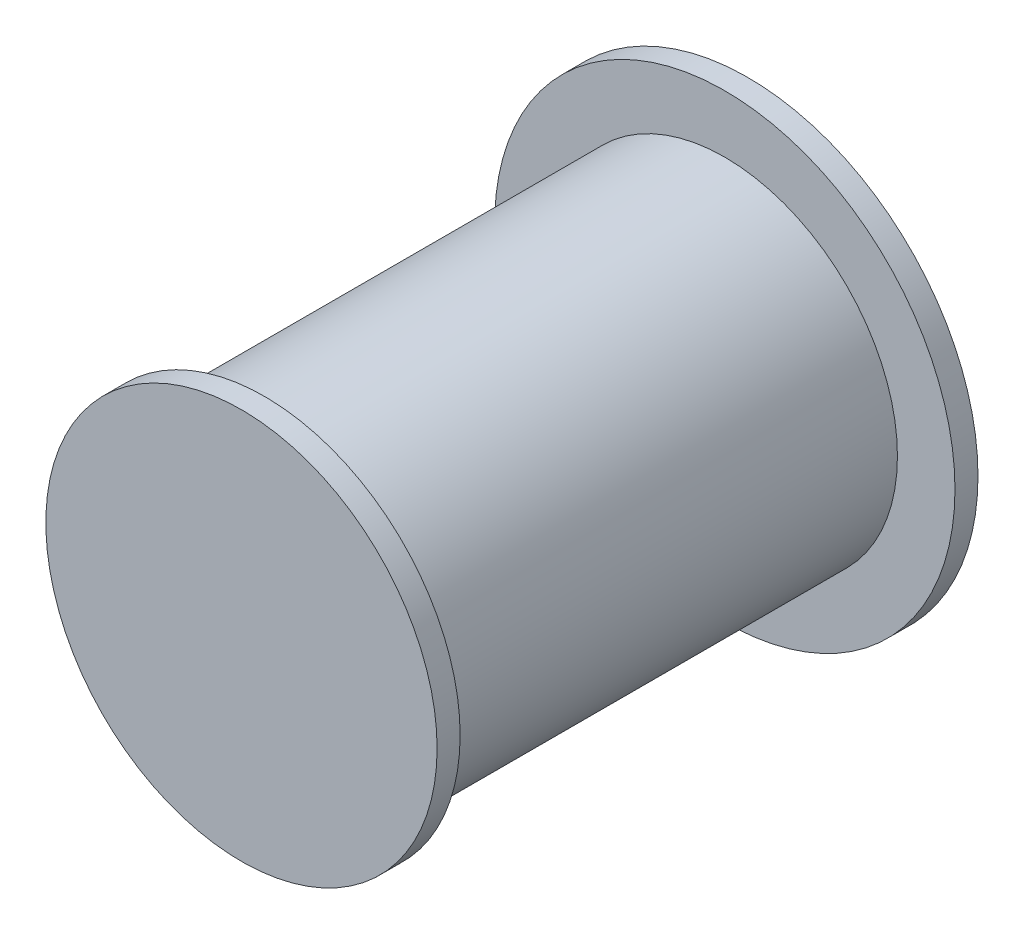
from build123d import *

# Parameters (mm, degrees)
SKETCH1_R           = 100
BOSS_EXTRUDE1_DEPTH = 10
SKETCH2_R           = 75
BOSS_EXTRUDE2_DEPTH = 200
SKETCH3_R           = 85
BOSS_EXTRUDE3_DEPTH = 10


with BuildPart() as part:
    # Sketch1 → Boss-Extrude1 (new body)
    with BuildSketch(Plane.XY):
        Circle(SKETCH1_R)
    extrude(amount=BOSS_EXTRUDE1_DEPTH)

    # Sketch2 → Boss-Extrude2 (add)
    with BuildSketch(Plane.XY.offset(10)):
        Circle(SKETCH2_R)
    extrude(amount=BOSS_EXTRUDE2_DEPTH)

    # Sketch3 → Boss-Extrude3 (add)
    with BuildSketch(Plane.XY.offset(210)):
        Circle(SKETCH3_R)
    extrude(amount=BOSS_EXTRUDE3_DEPTH)


solid = part.part
